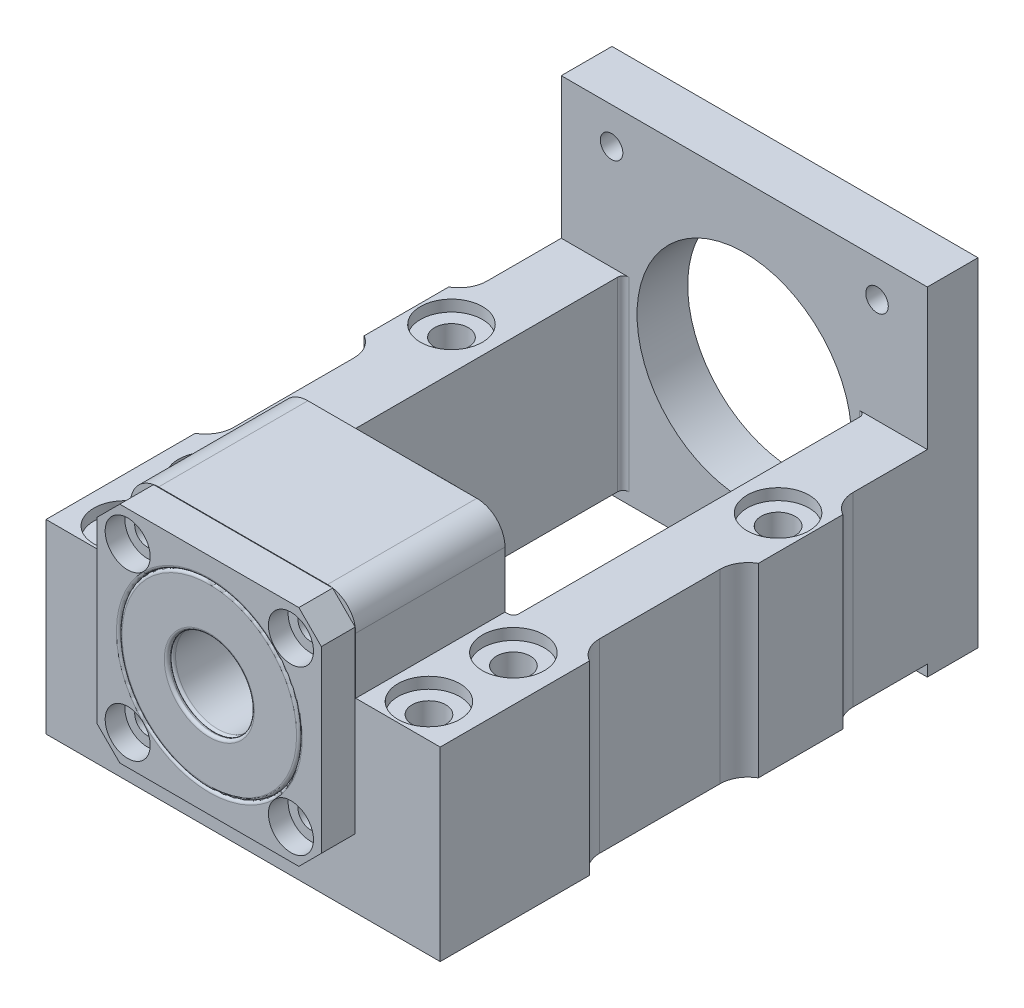
from build123d import *

# Parameters (mm, degrees)
BOSS_EXTRUDE1_DEPTH = 98
SKETCH2_R           = 3
CUT_EXTRUDE1_DEPTH  = 50
SKETCH3_R           = 5.5
CUT_EXTRUDE3_DEPTH  = 2
SKETCH4_W           = 65
SKETCH4_H           = 60
BOSS_EXTRUDE3_DEPTH = 9
SKETCH5_W           = 43
SKETCH5_H           = 62.5
CUT_EXTRUDE4_DEPTH  = 50
SKETCH6_W           = 40
SKETCH6_H           = 40
BOSS_EXTRUDE4_DEPTH = 26.5
SKETCH7_W           = 2.5
SKETCH7_H           = 26.5
SKETCH7_H_2         = 30
CUT_EXTRUDE5_DEPTH  = 50
FILLET1_R           = 5
SKETCH8_R           = 19.05
CUT_EXTRUDE6_DEPTH  = 10
SKETCH9_W           = 39.8
SKETCH9_H           = 39.8
BOSS_EXTRUDE5_DEPTH = 6
SKETCH10_R          = 16
CUT_EXTRUDE7_DEPTH  = 50
FILLET2_R           = 1
FILLET4_R           = 0.5
SKETCH11_R          = 16
SKETCH11_R_2        = 7.5
BOSS_EXTRUDE6_DEPTH = 1
SKETCH12_R          = 16
SKETCH12_R_2        = 7.5
BOSS_EXTRUDE7_DEPTH = 1
FILLET5_R           = 0.5
FILLET6_R           = 0.5
FILLET7_R           = 0.5
SKETCH13_R          = 16
SKETCH13_R_2        = 7.5
BOSS_EXTRUDE8_DEPTH = 30.5
FILLET8_R           = 0.5
SKETCH14_R          = 7.5
BOSS_EXTRUDE9_DEPTH = 8
CHAMFER1_SIZE       = 5
FILLET9_R           = 5
CHAMFER2_SIZE       = 4
SKETCH15_R          = 2
CUT_EXTRUDE8_DEPTH  = 10
SKETCH16_R          = 2.25
CUT_EXTRUDE9_DEPTH  = 6
SKETCH19_R          = 4
CUT_EXTRUDE10_DEPTH = 3.5


# Some blends are built 0.0001 mm under size
with BuildPart() as part:
    # Sketch1 → Boss-Extrude1 (new body)
    with BuildSketch(Plane.XY):
        Polygon((-35, -28), (35, -28), (35, 0), (35, 5), (-35, 5), (-35, 0), align=None)
    extrude(amount=-BOSS_EXTRUDE1_DEPTH)

    # Sketch2 → Cut-Extrude1 (cut)
    with BuildSketch(Plane(origin=(0, 5, 0), x_dir=(1, 0, 0), z_dir=(0, 1, 0))):
        with Locations(Location((-29, 66, 0), (0, 0, 270))):
            Circle(SKETCH2_R)
        with Locations(Location((29, 66, 0), (0, 0, 270))):
            Circle(SKETCH2_R)
        with Locations(Location((-27, 21, 0), (0, 0, 270))):
            Circle(SKETCH2_R)
        with Locations(Location((-27, 6, 0), (0, 0, 270))):
            Circle(SKETCH2_R)
        with Locations(Location((27, 21, 0), (0, 0, 270))):
            Circle(SKETCH2_R)
        with Locations(Location((27, 6, 0), (0, 0, 270))):
            Circle(SKETCH2_R)
    extrude(amount=-CUT_EXTRUDE1_DEPTH, mode=Mode.SUBTRACT)

    # Sketch3 → Cut-Extrude3 (cut)
    with BuildSketch(Plane(origin=(0, 5, 0), x_dir=(1, 0, 0), z_dir=(0, 1, 0))):
        with Locations(Location((-29, 66, 0), (0, 0, 270))):
            Circle(SKETCH3_R)
        with Locations(Location((29, 66, 0), (0, 0, 270))):
            Circle(SKETCH3_R)
        with Locations(Location((-27, 21, 0), (0, 0, 270))):
            Circle(SKETCH3_R)
        with Locations(Location((-27, 6, 0), (0, 0, 270))):
            Circle(SKETCH3_R)
        with Locations(Location((27, 21, 0), (0, 0, 270))):
            Circle(SKETCH3_R)
        with Locations(Location((27, 6, 0), (0, 0, 270))):
            Circle(SKETCH3_R)
    extrude(amount=-CUT_EXTRUDE3_DEPTH, mode=Mode.SUBTRACT)

    # Sketch4 → Boss-Extrude3 (add)
    with BuildSketch(Plane.XY.offset(-98)):
        Rectangle(SKETCH4_W, SKETCH4_H)
    extrude(amount=BOSS_EXTRUDE3_DEPTH)

    # Sketch5 → Cut-Extrude4 (cut)
    with BuildSketch(Plane(origin=(0, 5, 0), x_dir=(1, 0, 0), z_dir=(0, 1, 0))):
        with Locations((0, 57.75)):
            Rectangle(SKETCH5_W, SKETCH5_H)
    extrude(amount=-CUT_EXTRUDE4_DEPTH, mode=Mode.SUBTRACT)

    # Sketch6 → Boss-Extrude4 (add)
    with BuildSketch(Plane.XY):
        Rectangle(SKETCH6_W, SKETCH6_H)
    extrude(amount=-BOSS_EXTRUDE4_DEPTH)

    # Sketch7 → Cut-Extrude5 (cut)
    with BuildSketch(Plane(origin=(0, 5, 0), x_dir=(1, 0, 0), z_dir=(0, 1, 0))):
        with Locations((33.75, 84.75)):
            Rectangle(SKETCH7_W, SKETCH7_H)
        with Locations((-33.75, 84.75)):
            Rectangle(SKETCH7_W, SKETCH7_H)
        with Locations((33.75, 41.5)):
            Rectangle(SKETCH7_W, SKETCH7_H_2)
        with Locations((-33.75, 41.5)):
            Rectangle(SKETCH7_W, SKETCH7_H_2)
    extrude(amount=-CUT_EXTRUDE5_DEPTH, mode=Mode.SUBTRACT)

    # Fillet1
    # the kernel refuses this fillet: 5 mm, written as the material it adds along each edge
    with BuildSketch(Plane(origin=(32.5, 5, -71.5), x_dir=(0, 0, -1), z_dir=(0, -1, 0)), Plane(origin=(32.5, 5, -26.5), x_dir=(0, 0, -1), z_dir=(0, -1, 0)), Plane(origin=(-32.5, 5, -56.5), x_dir=(0, 0, 1), z_dir=(0, -1, 0))) as fillet1_piece_1:
        with BuildLine():
            CenterArc((4.330127019, 5), FILLET1_R, 210, 60)
            Line((0, 2.5), (-0.08660254, 2.45))
            ThreePointArc((-0.08660254, 2.45), (-0.1, 1.25), (-0.1, 0))
            Line((-0.1, 0), (0, -0.1))
            Line((0, -0.1), (4.330127019, -0.1))
            Line((4.330127019, -0.1), (4.330127019, 0))
        make_face()
    extrude(amount=33)
    with BuildSketch(Plane(origin=(32.5, 5, -56.5), x_dir=(1, 0, 0), z_dir=(0, -1, 0)), Plane(origin=(-32.5, 5, -26.5), x_dir=(-1, 0, 0), z_dir=(0, -1, 0)), Plane(origin=(-32.5, 5, -71.5), x_dir=(-1, 0, 0), z_dir=(0, -1, 0))) as fillet1_piece_2:
        with BuildLine():
            CenterArc((5, 4.330127019), FILLET1_R, 180, 60)
            Line((0, 4.330127019), (-0.1, 4.330127019))
            Line((-0.1, 4.330127019), (-0.1, 0))
            Line((-0.1, 0), (0, -0.1))
            ThreePointArc((0, -0.1), (1.25, -0.1), (2.45, -0.08660254))
            Line((2.45, -0.08660254), (2.5, 0))
        make_face()
    extrude(amount=33)

    # Sketch8 → Cut-Extrude6 (cut)
    with BuildSketch(Plane.XY.offset(-98)):
        Circle(SKETCH8_R)
    extrude(amount=CUT_EXTRUDE6_DEPTH, mode=Mode.SUBTRACT)


with BuildPart() as body_2:
    # Sketch9 → Boss-Extrude5 (new body)
    with BuildSketch(Plane.XY):
        Rectangle(SKETCH9_W, SKETCH9_H)
    extrude(amount=BOSS_EXTRUDE5_DEPTH)


with BuildPart() as cut_extrude7_tool:
    # Sketch10 → Cut-Extrude7 (new body)
    with BuildSketch(Plane.XY.offset(-26.5)):
        with Locations(Location((0, 0, 0), (0, 0, 180))):
            Circle(SKETCH10_R)
    extrude(amount=CUT_EXTRUDE7_DEPTH)


with BuildPart() as part_1:
    add(part.part)

    # Cut-Extrude7: cut by cut_extrude7_tool
    add(cut_extrude7_tool.part, mode=Mode.SUBTRACT)

    # Fillet2
    fillet2_edges = [part_1.edges().sort_by_distance(p)[0] for p in [
        (-21.5, -11.5, -89),
        (21.5, -11.5, -89),
        (21.5, -11.5, -26.5),
        (-21.5, -11.5, -26.5),
    ]]
    fillet(fillet2_edges, radius=FILLET2_R)

    # Fillet6
    fillet6_edges = [part_1.edges().sort_by_distance(p)[0] for p in [
        (16, 0, -26.5),
    ]]
    fillet(fillet6_edges, radius=FILLET6_R)

    # Fillet9
    fillet9_edges = [part_1.edges().sort_by_distance(p)[0] for p in [
        (20, 20, -13.25),
        (-20, 20, -13.25),
    ]]
    fillet(fillet9_edges, radius=FILLET9_R)

    # Sketch15 → Cut-Extrude8 (cut)
    with BuildSketch(Plane.XY.offset(-98)):
        with Locations((-23.57, 23.57)):
            Circle(SKETCH15_R)
        with Locations((-23.57, -23.57)):
            Circle(SKETCH15_R)
        with Locations((23.57, -23.57)):
            Circle(SKETCH15_R)
        with Locations((23.57, 23.57)):
            Circle(SKETCH15_R)
    extrude(amount=CUT_EXTRUDE8_DEPTH, mode=Mode.SUBTRACT)


with BuildPart() as body_2_1:
    add(body_2.part)

    # Cut-Extrude7: cut by cut_extrude7_tool
    add(cut_extrude7_tool.part, mode=Mode.SUBTRACT)

    # Fillet4
    fillet4_edges = [body_2_1.edges().sort_by_distance(p)[0] for p in [
        (16, 0, 0),
        (16, 0, 6),
    ]]
    fillet(fillet4_edges, radius=FILLET4_R)

    # Chamfer2
    chamfer2_edges = [body_2_1.edges().sort_by_distance(p)[0] for p in [
        (19.9, -19.9, 3),
        (-19.9, -19.9, 3),
        (-19.9, 19.9, 3),
        (19.9, 19.9, 3),
    ]]
    chamfer(chamfer2_edges, length=CHAMFER2_SIZE)

    # Sketch16 → Cut-Extrude9 (cut)
    with BuildSketch(Plane.XY.offset(6)):
        with Locations((14.495689014, 14.495689014)):
            Circle(SKETCH16_R)
        with Locations((-14.495689014, 14.495689014)):
            Circle(SKETCH16_R)
        with Locations((-14.495689014, -14.495689014)):
            Circle(SKETCH16_R)
        with Locations((14.495689014, -14.495689014)):
            Circle(SKETCH16_R)
    extrude(amount=-CUT_EXTRUDE9_DEPTH, mode=Mode.SUBTRACT)

    # Sketch19 → Cut-Extrude10 (cut)
    with BuildSketch(Plane.XY.offset(6)):
        with Locations((-14.495689014, 14.495689014)):
            Circle(SKETCH19_R)
        with Locations((14.495689014, 14.495689014)):
            Circle(SKETCH19_R)
        with Locations((14.495689014, -14.495689014)):
            Circle(SKETCH19_R)
        with Locations((-14.495689014, -14.495689014)):
            Circle(SKETCH19_R)
    extrude(amount=-CUT_EXTRUDE10_DEPTH, mode=Mode.SUBTRACT)


with BuildPart() as body_3:
    # Sketch11 → Boss-Extrude6 (new body)
    with BuildSketch(Plane.XY.offset(6)):
        Circle(SKETCH11_R)
        Circle(SKETCH11_R_2, mode=Mode.SUBTRACT)
    extrude(amount=-BOSS_EXTRUDE6_DEPTH)

    # Fillet5
    fillet5_edges = [body_3.edges().sort_by_distance(p)[0] for p in [
        (-16, 0, 6),
        (-7.5, 0, 5),
        (-7.5, 0, 6),
    ]]
    fillet(fillet5_edges, radius=FILLET5_R - 0.0001)  # a hair under: the kernel refuses the full size


with BuildPart() as body_4:
    # Sketch12 → Boss-Extrude7 (new body)
    with BuildSketch(Plane.XY.offset(-26.5)):
        Circle(SKETCH12_R)
        Circle(SKETCH12_R_2, mode=Mode.SUBTRACT)
    extrude(amount=BOSS_EXTRUDE7_DEPTH)

    # Fillet7
    fillet7_edges = [body_4.edges().sort_by_distance(p)[0] for p in [
        (-16, 0, -26.5),
        (-16, 0, -25.5),
        (-7.5, 0, -26.5),
        (-7.5, 0, -25.5),
    ]]
    fillet(fillet7_edges, radius=FILLET7_R - 0.0001)  # a hair under: the kernel refuses the full size


with BuildPart() as body_5:
    # Sketch13 → Boss-Extrude8 (new body)
    with BuildSketch(Plane.XY.offset(5)):
        Circle(SKETCH13_R)
        Circle(SKETCH13_R_2, mode=Mode.SUBTRACT)
    extrude(amount=-BOSS_EXTRUDE8_DEPTH)

    # Fillet8
    fillet8_edges = [body_5.edges().sort_by_distance(p)[0] for p in [
        (-7.5, 0, -25.5),
        (-7.5, 0, 5),
    ]]
    fillet(fillet8_edges, radius=FILLET8_R)


with BuildPart() as body_6:
    # Sketch14 → Boss-Extrude9 (new body)
    with BuildSketch(Plane.XY.offset(-26.5)):
        Polygon((-15.556349186, 0), (0, 15.556349186), (15.556349186, 0), (0, -15.556349186), align=None)
        Circle(SKETCH14_R, mode=Mode.SUBTRACT)
    extrude(amount=-BOSS_EXTRUDE9_DEPTH)

    # Chamfer1
    chamfer1_edges = [body_6.edges().sort_by_distance(p)[0] for p in [
        (-15.556349186, 0, -30.5),
        (0, 15.556349186, -30.5),
        (15.556349186, 0, -30.5),
        (0, -15.556349186, -30.5),
    ]]
    chamfer(chamfer1_edges, length=CHAMFER1_SIZE)


solid = Compound([part_1.part, body_2_1.part, body_3.part, body_4.part, body_5.part, body_6.part])
